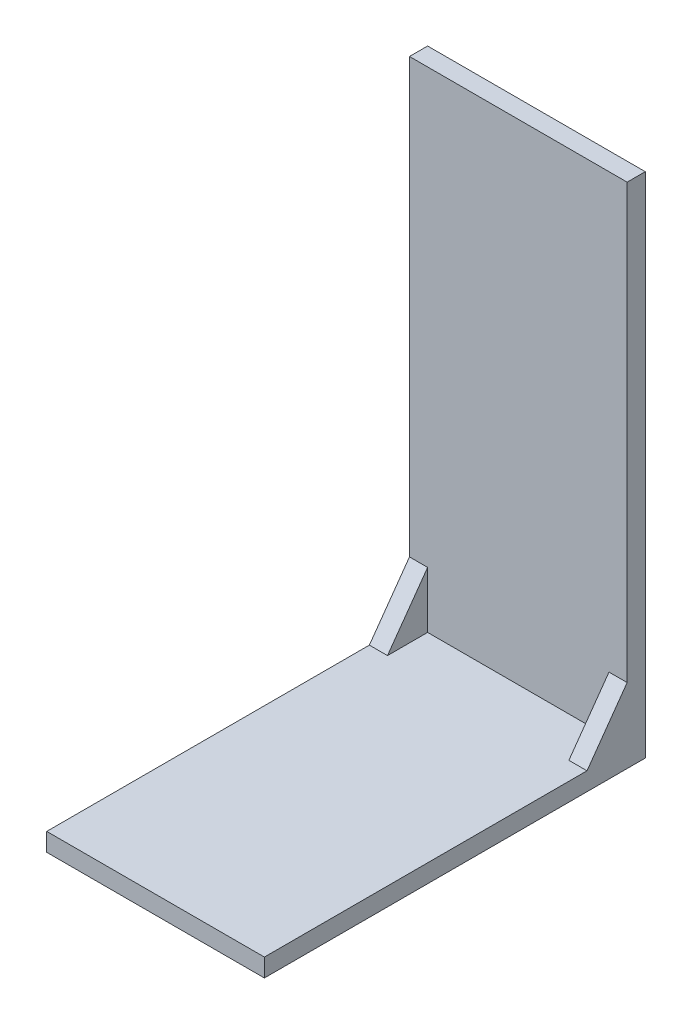
from build123d import *

# Parameters (mm, degrees)
SKETCH1_W  = 76.2
SKETCH1_H  = 177.8
RISE_DEPTH = 6.35
SKETCH2_W  = 76.2
SKETCH2_H  = 6.35
BASE_DEPTH = 127
RIB_DEPTH  = 6.35


with BuildPart() as part:
    # Sketch1 → Rise (new body)
    with BuildSketch(Plane.XY):
        with Locations((38.1, 88.9)):
            Rectangle(SKETCH1_W, SKETCH1_H)
    extrude(amount=RISE_DEPTH)

    # Sketch2 → Base (add)
    with BuildSketch(Plane.XY.offset(6.35)):
        with Locations((38.1, 3.175)):
            Rectangle(SKETCH2_W, SKETCH2_H)
    extrude(amount=BASE_DEPTH)

    # Sketch4 → Rib (add)
    with BuildSketch(Plane(origin=(76.2, 0, 0), x_dir=(0, 0, -1), z_dir=(1, 0, 0))):
        Polygon((-6.35, 26.072630174), (-6.35, 6.35), (-20.400204784, 6.35), align=None)
    rib = extrude(amount=-RIB_DEPTH)

    # RibCopy: Rib across plane
    add(rib.mirror(Plane.ZY.offset(-38.1)))


solid = part.part
